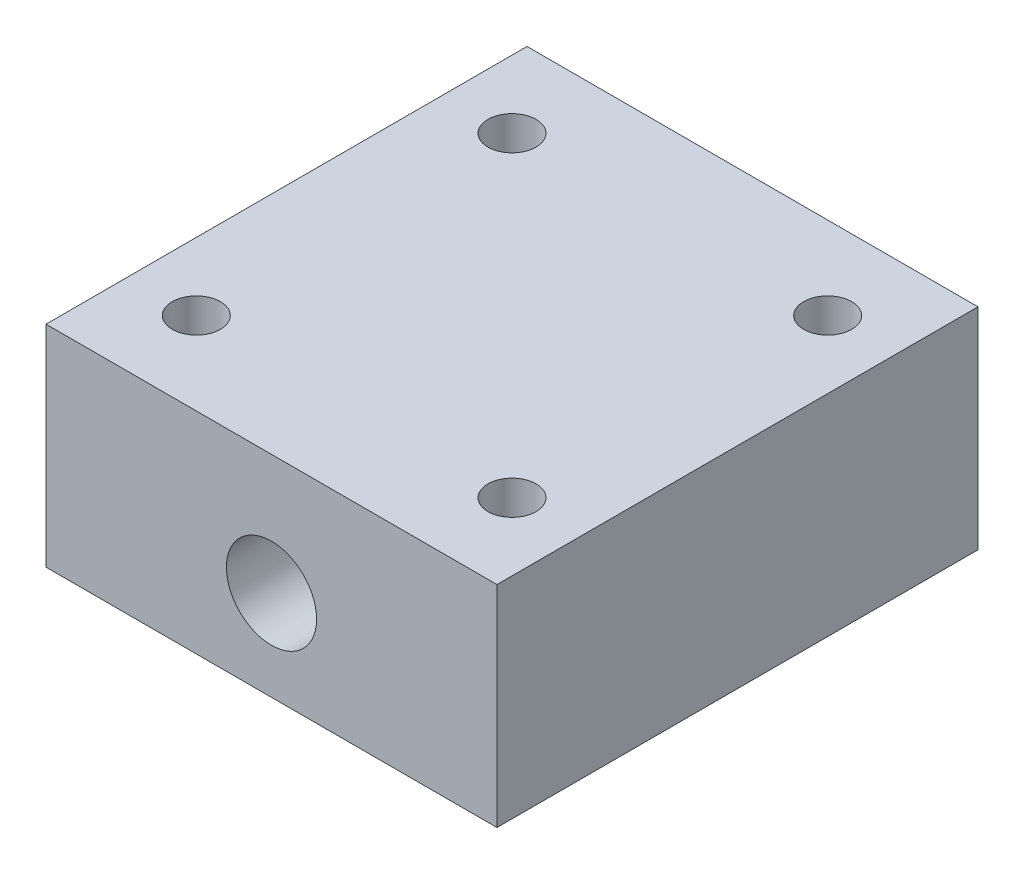
from build123d import *

# Parameters (mm, degrees)
SKETCH1_W                = 30
SKETCH1_H                = 32
BOSS_EXTRUDE1_DEPTH      = 14
CAVITY1_START            = 44.284378121
CAVITY1_OUTLINE_R        = 3
CAVITY1_DEPTH            = 32
M3_CLEARANCE_HOLE1_D     = 3.2
M3_CLEARANCE_HOLE1_DEPTH = 7
M3_CLEARANCE_HOLE1_TIP   = 0.96137699


# Read off the part's stored shape, not the designer's step: Cavity1
with BuildPart() as part:
    # Sketch1 → Boss-Extrude1 (new body)
    with BuildSketch(Plane(origin=(0, 8, 0), x_dir=(1, 0, 0), z_dir=(0, 1, 0))):
        with Locations((0, -60.284378121)):
            Rectangle(SKETCH1_W, SKETCH1_H)
    extrude(amount=-BOSS_EXTRUDE1_DEPTH)

    # Cavity1 outline → Cavity1 (cut)
    with BuildSketch(Plane.XY.offset(CAVITY1_START)):
        Circle(CAVITY1_OUTLINE_R)
    extrude(amount=CAVITY1_DEPTH, mode=Mode.SUBTRACT)

    # M3 Clearance Hole1
    with Locations(Plane(origin=(0, 8, 0), x_dir=(1, 0, 0), z_dir=(0, 1, 0))):
        with Locations((10.5, -49.784378121), (-10.5, -49.784378121), (-10.5, -70.784378121), (10.5, -70.784378121)):
            Hole(M3_CLEARANCE_HOLE1_D / 2, depth=M3_CLEARANCE_HOLE1_DEPTH)
            with Locations((0, 0, -(M3_CLEARANCE_HOLE1_DEPTH + M3_CLEARANCE_HOLE1_TIP / 2))):  # 118° drill point
                Cone(0, M3_CLEARANCE_HOLE1_D / 2, M3_CLEARANCE_HOLE1_TIP, mode=Mode.SUBTRACT)


solid = part.part
